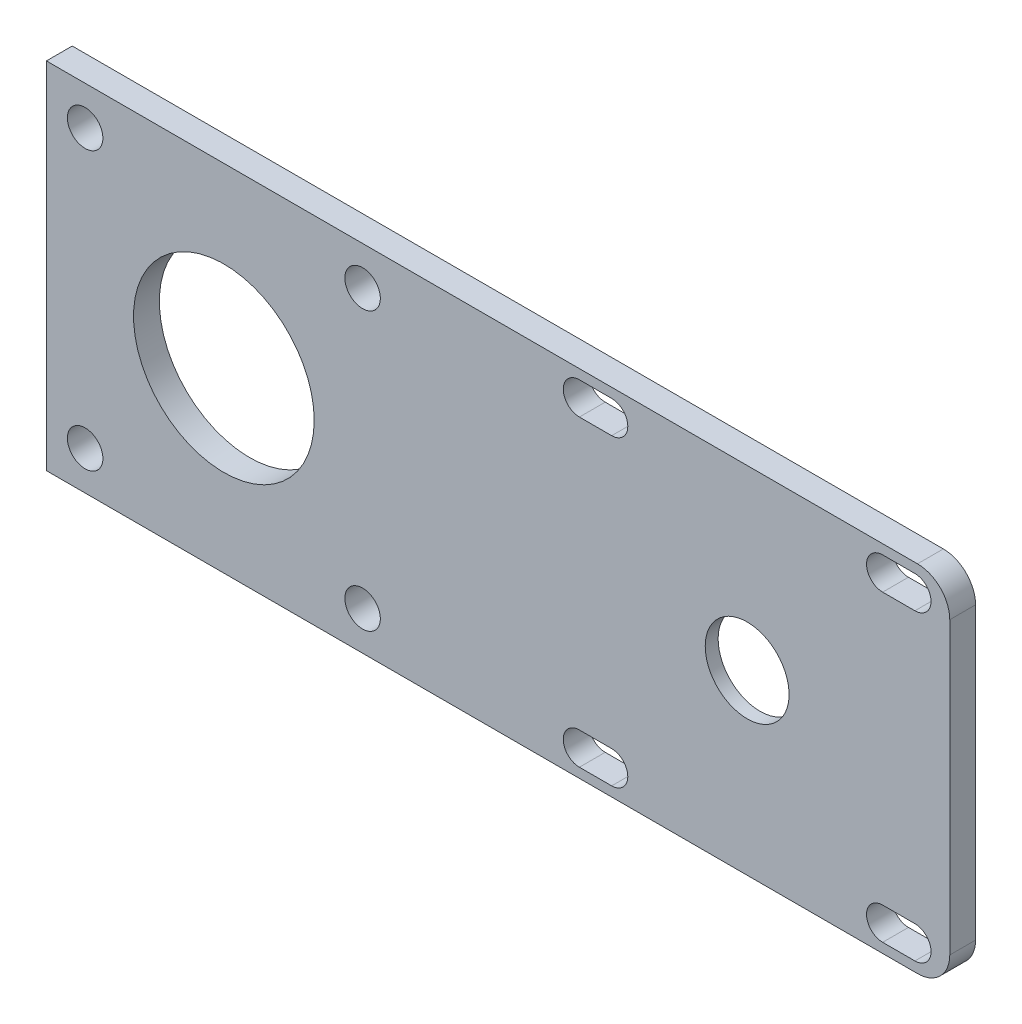
from build123d import *

# Parameters (mm, degrees)
SCHIZZO1_W                   = 140
SCHIZZO1_H                   = 55
ESTRUSIONE_ESTRUSIONE1_DEPTH = 4
SCHIZZO2_R                   = 14
SCHIZZO2_R_2                 = 2.75
TAGLIO_ESTRUSIONE1_DEPTH     = 151.469265965
RACCORDO1_R                  = 5
SCHIZZO3_R                   = 6.5
TAGLIO_ESTRUSIONE2_DEPTH     = 151.469265965
TAGLIO_ESTRUSIONE3_DEPTH     = 2


with BuildPart() as part:
    # Schizzo1 → Estrusione-Estrusione1 (new body)
    with BuildSketch(Plane.XY):
        with Locations((70, 27.5)):
            Rectangle(SCHIZZO1_W, SCHIZZO1_H)
    extrude(amount=-ESTRUSIONE_ESTRUSIONE1_DEPTH)

    # Schizzo2 → Taglio-Estrusione1 (cut, through all)
    with BuildSketch(Plane.XY):
        with Locations((27.5, 27.5)):
            Circle(SCHIZZO2_R)
        with Locations((6, 6)):
            Circle(SCHIZZO2_R_2)
        with Locations((49, 6)):
            Circle(SCHIZZO2_R_2)
        with Locations((49, 49)):
            Circle(SCHIZZO2_R_2)
        with Locations((6, 49)):
            Circle(SCHIZZO2_R_2)
    extrude(amount=-TAGLIO_ESTRUSIONE1_DEPTH, mode=Mode.SUBTRACT)

    # Raccordo1
    raccordo1_edges = [part.edges().sort_by_distance(p)[0] for p in [
        (140, 0, -2),
        (140, 55, -2),
    ]]
    fillet(raccordo1_edges, radius=RACCORDO1_R)

    # Schizzo3 → Taglio-Estrusione2 (cut, through all)
    with BuildSketch(Plane(origin=(0, 0, -4), x_dir=(-1, 0, 0), z_dir=(0, 0, -1))):
        with Locations((-108.6, 27.5)):
            Circle(SCHIZZO3_R)
        with BuildLine():
            Line((-134.6, 53.5), (-129.6, 53.5))
            ThreePointArc((-129.6, 53.5), (-127.1, 51), (-129.6, 48.5))
            Line((-129.6, 48.5), (-134.6, 48.5))
            ThreePointArc((-134.6, 48.5), (-137.1, 51), (-134.6, 53.5))
        make_face()
        with BuildLine():
            Line((-82.6, 53.5), (-87.6, 53.5))
            ThreePointArc((-87.6, 53.5), (-90.1, 51), (-87.6, 48.5))
            Line((-87.6, 48.5), (-82.6, 48.5))
            ThreePointArc((-82.6, 48.5), (-80.1, 51), (-82.6, 53.5))
        make_face()
        with BuildLine():
            Line((-134.6, 1.5), (-129.6, 1.5))
            ThreePointArc((-129.6, 1.5), (-127.1, 4), (-129.6, 6.5))
            Line((-129.6, 6.5), (-134.6, 6.5))
            ThreePointArc((-134.6, 6.5), (-137.1, 4), (-134.6, 1.5))
        make_face()
        with BuildLine():
            Line((-82.6, 1.5), (-87.6, 1.5))
            ThreePointArc((-87.6, 1.5), (-90.1, 4), (-87.6, 6.5))
            Line((-87.6, 6.5), (-82.6, 6.5))
            ThreePointArc((-82.6, 6.5), (-80.1, 4), (-82.6, 1.5))
        make_face()
    extrude(amount=-TAGLIO_ESTRUSIONE2_DEPTH, mode=Mode.SUBTRACT)

    # Schizzo4 → Taglio-Estrusione3 (cut)
    with BuildSketch(Plane(origin=(0, 0, -4), x_dir=(-1, 0, 0), z_dir=(0, 0, -1))):
        with BuildLine():
            Line((-88.6, 9), (-128.6, 9))
            ThreePointArc((-128.6, 9), (-132.135533906, 10.464466094), (-133.6, 14))
            Line((-133.6, 14), (-133.6, 41))
            ThreePointArc((-133.6, 41), (-132.135533906, 44.535533906), (-128.6, 46))
            Line((-128.6, 46), (-88.6, 46))
            ThreePointArc((-88.6, 46), (-85.064466094, 44.535533906), (-83.6, 41))
            Line((-83.6, 41), (-83.6, 14))
            ThreePointArc((-83.6, 14), (-85.064466094, 10.464466094), (-88.6, 9))
        make_face()
    extrude(amount=-TAGLIO_ESTRUSIONE3_DEPTH, mode=Mode.SUBTRACT)


solid = part.part
